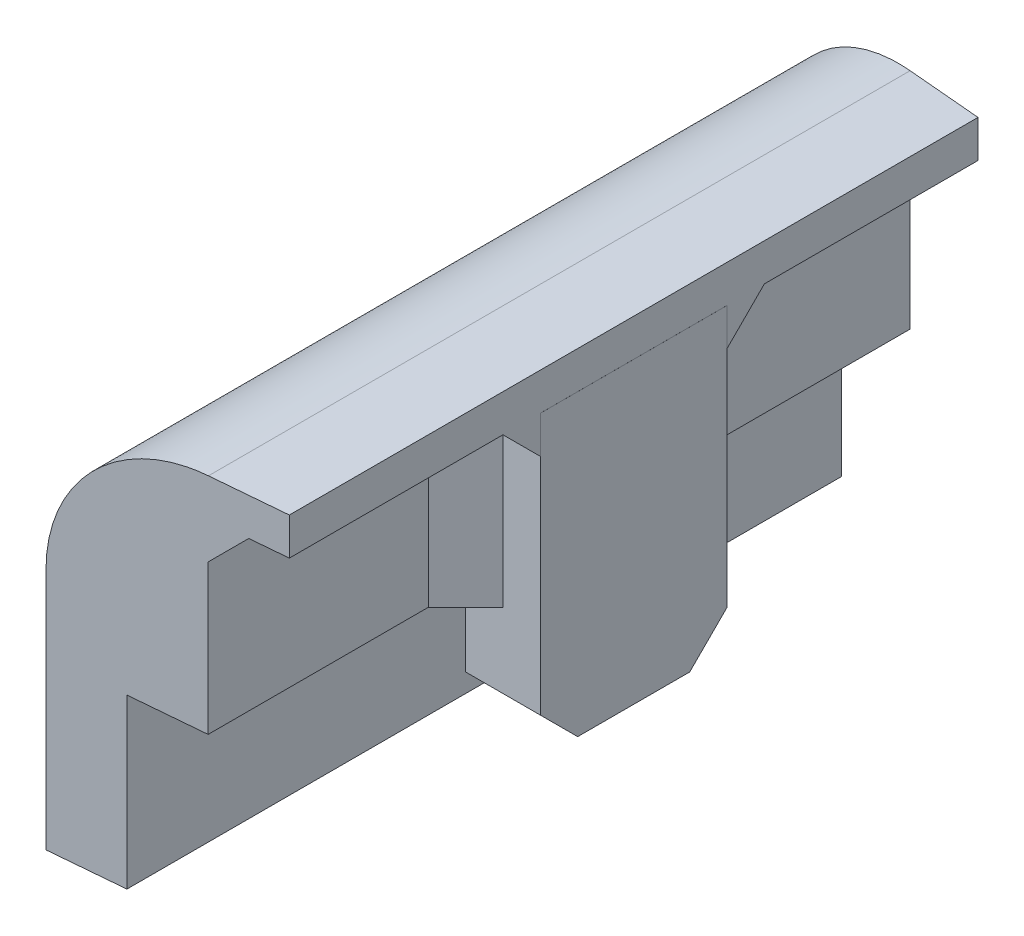
from build123d import *

# Parameters (mm, degrees)
BOSS_EXTRUDE1_START       = -61.874871948
BOSS_EXTRUDE1_DEPTH       = 61.874871948
BOSS_EXTRUDE1_START_2     = 33.418244096
BOSS_EXTRUDE1_2_OUTLINE_W = 41
BOSS_EXTRUDE1_2_OUTLINE_H = 70
BOSS_EXTRUDE1_2_DEPTH     = 4.581755904
SKETCH2_W                 = 31.75
SKETCH2_H                 = 50.8
BOSS_EXTRUDE2_DEPTH       = 12.7
CHAMFER1_SIZE             = 6.35


with BuildPart() as part:
    # Boss-Extrude1: read off the stored shape, not the designer's step
    # Boss-Extrude1 outline → Boss-Extrude1 (new body)
    with BuildSketch(Plane.XY.offset(BOSS_EXTRUDE1_START)):
        with BuildLine():
            Line((-285.755139406, 85.725), (-285.755139406, 92.075))
            Line((-285.755139406, 92.075), (-298.401672666, 92.075))
            ThreePointArc((-298.401672666, 92.075), (-316.362184908, 84.635512242), (-323.801672666, 66.675))
            Line((-323.801672666, 66.675), (-323.801672666, 25.4))
            Line((-323.801672666, 25.4), (-311.15, 25.4))
            Line((-311.15, 25.4), (-311.15, 53.975))
            Line((-311.15, 53.975), (-298.45, 53.975))
            Line((-298.45, 53.975), (-298.45, 85.725))
            Line((-298.45, 85.725), (-285.755139406, 85.725))
        make_face()
    boss_extrude1 = extrude(amount=BOSS_EXTRUDE1_DEPTH)

    # Boss-Extrude1 2 outline → Boss-Extrude1 2 (cut)
    with BuildSketch(Plane(origin=(0, 0, 0), x_dir=(0.9961946980917459, 0, 0.08715574274765299), z_dir=(0.087155742747653, 0, -0.996194698091746)).offset(BOSS_EXTRUDE1_START_2)):
        with Locations((-308.5, -59)):
            Rectangle(BOSS_EXTRUDE1_2_OUTLINE_W, BOSS_EXTRUDE1_2_OUTLINE_H)
    boss_extrude1_2 = extrude(amount=BOSS_EXTRUDE1_2_DEPTH, mode=Mode.SUBTRACT)

    # Mirror1: Boss-Extrude1, Boss-Extrude1 2 across plane
    add(boss_extrude1.mirror(Plane.XY))
    add(boss_extrude1_2.mirror(Plane.XY), mode=Mode.SUBTRACT)

    # Sketch2 → Boss-Extrude2 (add)
    with BuildSketch(Plane(origin=(-298.45, 0, 0), x_dir=(0, 0, -1), z_dir=(1, 0, 0))):
        with Locations((0, 60.325)):
            Rectangle(SKETCH2_W, SKETCH2_H)
    extrude(amount=BOSS_EXTRUDE2_DEPTH)

    # Chamfer1
    chamfer1_edges = [part.edges().sort_by_distance(p)[0] for p in [
        (-292.1, 34.925, -15.875),
        (-292.1, 34.925, 15.875),
        (-292.102569703, 85.725, -15.875),
        (-298.45, 85.725, -37.765943994),
        (-298.45, 69.85, -15.875),
        (-298.45, 85.725, 37.765943994),
        (-292.102569703, 85.725, 15.875),
        (-298.45, 69.85, 15.875),
    ]]
    chamfer(chamfer1_edges, length=CHAMFER1_SIZE)


solid = part.part
